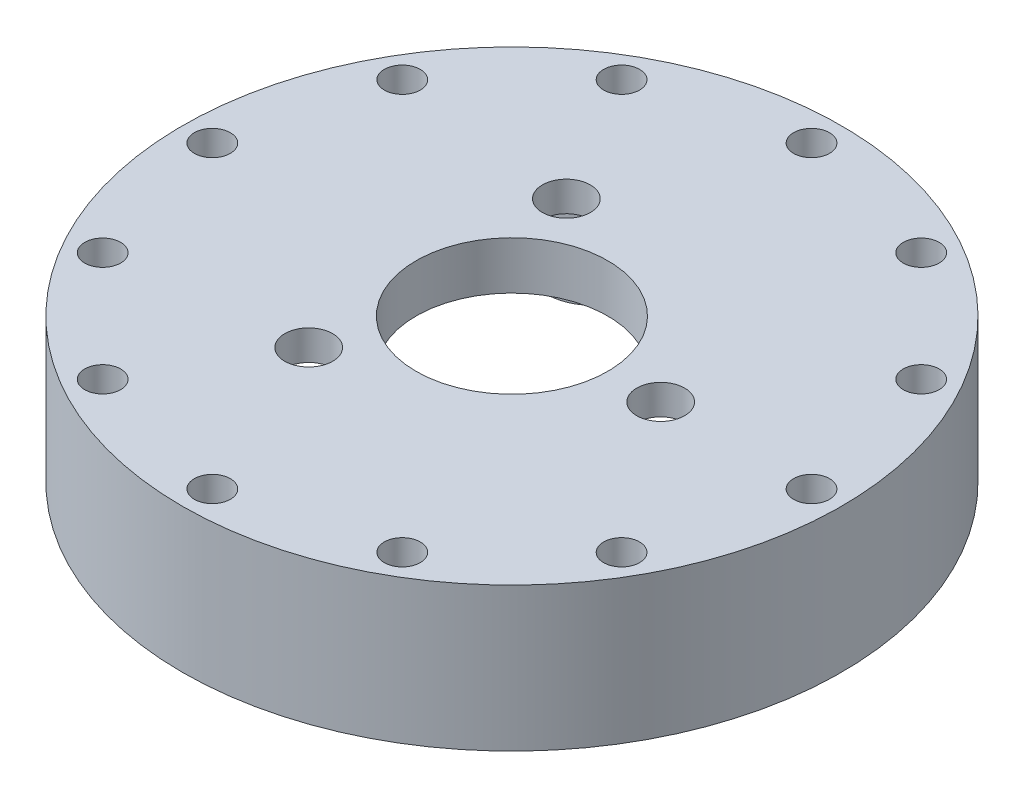
from build123d import *

# Parameters (mm, degrees)
SKETCH1_R           = 27.5
BOSS_EXTRUDE2_DEPTH = 8
SKETCH2_R           = 27.5
SKETCH2_R_2         = 8
SKETCH2_R_3         = 2
BOSS_EXTRUDE3_DEPTH = 4
FILLET2_R           = 1
SKETCH8_R           = 1.5
CUT_EXTRUDE1_DEPTH  = 41.700122985
SKETCH9_R           = 4.25
CUT_EXTRUDE2_DEPTH  = 1.5


with BuildPart() as part:
    # Sketch1 → Boss-Extrude2 (new body)
    with BuildSketch(Plane(origin=(0, 0, 0), x_dir=(1, 0, 0), z_dir=(0, 1, 0))):
        Circle(SKETCH1_R)
        with BuildLine():
            ThreePointArc((22.488576724, 0.716879998), (18.385933283, -2.643498121), (21.375662918, -7.023605541))
            ThreePointArc((21.375662918, -7.023605541), (20.466719895, -9.346837793), (19.306169205, -11.555164673))
            ThreePointArc((19.306169205, -11.555164673), (14.038048344, -12.164038133), (14.185104106, -17.465188849))
            ThreePointArc((14.185104106, -17.465188849), (12.164418393, -18.928204489), (9.994189375, -20.158526204))
            ThreePointArc((9.994189375, -20.158526204), (5.233182243, -17.822581985), (2.490874966, -22.3616981))
            ThreePointArc((2.490874966, -22.3616981), (0, -22.5), (-2.490874966, -22.3616981))
            ThreePointArc((-2.490874966, -22.3616981), (-5.233182243, -17.822581985), (-9.994189375, -20.158526204))
            ThreePointArc((-9.994189375, -20.158526204), (-12.164418393, -18.928204489), (-14.185104106, -17.465188849))
            ThreePointArc((-14.185104106, -17.465188849), (-14.038048344, -12.164038133), (-19.306169205, -11.555164673))
            ThreePointArc((-19.306169205, -11.555164673), (-20.466719895, -9.346837793), (-21.375662918, -7.023605541))
            ThreePointArc((-21.375662918, -7.023605541), (-18.385933283, -2.643498121), (-22.488576724, 0.716879998))
            ThreePointArc((-22.488576724, 0.716879998), (-22.270982442, 3.202083861), (-21.779599788, 5.647922899))
            ThreePointArc((-21.779599788, 5.647922899), (-16.896414314, 7.716333867), (-18.531020029, 12.761320334))
            ThreePointArc((-18.531020029, 12.761320334), (-17.004365423, 14.734366514), (-15.268667612, 16.526275725))
            ThreePointArc((-15.268667612, 16.526275725), (-10.042403184, 15.626284372), (-8.689995409, 20.754131632))
            ThreePointArc((-8.689995409, 20.754131632), (-6.338982529, 21.588591906), (-3.910041353, 22.157652778))
            ThreePointArc((-3.910041353, 22.157652778), (0, 18.575), (3.910041353, 22.157652778))
            ThreePointArc((3.910041353, 22.157652778), (6.338982529, 21.588591906), (8.689995409, 20.754131632))
            ThreePointArc((8.689995409, 20.754131632), (10.042403184, 15.626284372), (15.268667612, 16.526275725))
            ThreePointArc((15.268667612, 16.526275725), (17.004365423, 14.734366514), (18.531020029, 12.761320334))
            ThreePointArc((18.531020029, 12.761320334), (16.896414314, 7.716333867), (21.779599788, 5.647922899))
            ThreePointArc((21.779599788, 5.647922899), (22.270982442, 3.202083861), (22.488576724, 0.716879998))
        make_face(mode=Mode.SUBTRACT)
    extrude(amount=BOSS_EXTRUDE2_DEPTH)

    # Sketch2 → Boss-Extrude3 (add)
    with BuildSketch(Plane(origin=(0, 8, 0), x_dir=(1, 0, 0), z_dir=(0, 1, 0))):
        Circle(SKETCH2_R)
        Circle(SKETCH2_R_2, mode=Mode.SUBTRACT)
        with Locations((-6.206515394, 10.75)):
            Circle(SKETCH2_R_3, mode=Mode.SUBTRACT)
        with Locations((12.413030788, 0)):
            Circle(SKETCH2_R_3, mode=Mode.SUBTRACT)
        with Locations((-6.206515394, -10.75)):
            Circle(SKETCH2_R_3, mode=Mode.SUBTRACT)
    extrude(amount=BOSS_EXTRUDE3_DEPTH)

    # Fillet2
    fillet2_edges = [part.edges().sort_by_distance(p)[0] for p in [
        (19.306169205, 4, 11.555164673),
        (9.994189375, 4, 20.158526204),
        (2.490874966, 4, 22.3616981),
        (14.185104106, 4, 17.465188849),
        (-2.490874966, 4, 22.3616981),
        (-9.994189375, 4, 20.158526204),
        (-14.185104106, 4, 17.465188849),
        (-19.306169205, 4, 11.555164673),
        (-21.375662918, 4, 7.023605541),
        (-22.488576724, 4, -0.716879998),
        (-21.779599788, 4, -5.647922899),
        (-18.531020029, 4, -12.761320334),
        (-15.268667612, 4, -16.526275725),
        (-8.689995409, 4, -20.754131632),
        (-3.910041353, 4, -22.157652778),
        (3.910041353, 4, -22.157652778),
        (8.689995409, 4, -20.754131632),
        (15.268667612, 4, -16.526275725),
        (18.531020029, 4, -12.761320334),
        (21.779599788, 4, -5.647922899),
        (22.488576724, 4, -0.716879998),
        (21.375662918, 4, 7.023605541),
    ]]
    fillet(fillet2_edges, radius=FILLET2_R)

    # Sketch8 → Cut-Extrude1 (cut, through all)
    with BuildSketch(Plane.XZ):
        with Locations((0, -25)):
            Circle(SKETCH8_R)
        with Locations((-12.5, -21.650635095)):
            Circle(SKETCH8_R)
        with Locations((-21.650635095, -12.5)):
            Circle(SKETCH8_R)
        with Locations((-25, 0)):
            Circle(SKETCH8_R)
        with Locations((-21.650635095, 12.5)):
            Circle(SKETCH8_R)
        with Locations((-12.5, 21.650635095)):
            Circle(SKETCH8_R)
        with Locations((0, 25)):
            Circle(SKETCH8_R)
        with Locations((12.5, 21.650635095)):
            Circle(SKETCH8_R)
        with Locations((21.650635095, 12.5)):
            Circle(SKETCH8_R)
        with Locations((25, 0)):
            Circle(SKETCH8_R)
        with Locations((21.650635095, -12.5)):
            Circle(SKETCH8_R)
        with Locations((12.5, -21.650635095)):
            Circle(SKETCH8_R)
    extrude(amount=-CUT_EXTRUDE1_DEPTH, mode=Mode.SUBTRACT)

    # Sketch9 → Cut-Extrude2 (cut)
    with BuildSketch(Plane.XZ.offset(-8)):
        with Locations((12.413030788, 0)):
            Circle(SKETCH9_R)
        with Locations((-6.206515394, -10.75)):
            Circle(SKETCH9_R)
        with Locations((-6.206515394, 10.75)):
            Circle(SKETCH9_R)
    extrude(amount=-CUT_EXTRUDE2_DEPTH, mode=Mode.SUBTRACT)


solid = part.part
